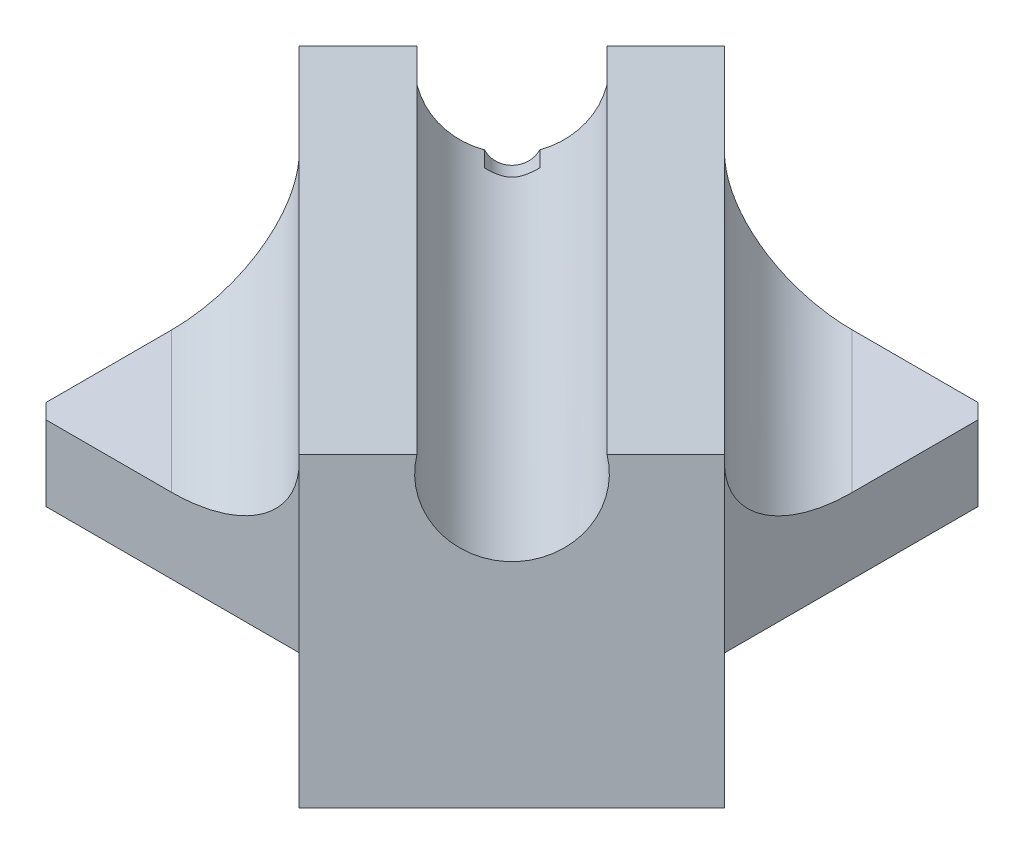
from build123d import *

# Parameters (mm, degrees)
SKETCH1_W                = 32
SKETCH1_H                = 32
BOSS_EXTRUDE1_DEPTH      = 5
BOSS_EXTRUDE2_DEPTH      = 24
BOSS_EXTRUDE2_DEPTH_BACK = 21
SKETCH3_W                = 21.632810856
SKETCH3_H                = 9.374415515
CUT_EXTRUDE1_DEPTH       = 26
CUT_EXTRUDE3_DEPTH       = 3
BOSS_EXTRUDE3_REACH      = 38.453
BOSS_EXTRUDE4_REACH      = 39.779
CHAMFER2_SIZE            = 1
FILLET3_R                = 6
CHAMFER3_SIZE            = 1


with BuildPart() as part:
    # Sketch1 → Boss-Extrude1 (new body)
    with BuildSketch(Plane(origin=(0, 0, 0), x_dir=(1, 0, 0), z_dir=(0, 1, 0))):
        Rectangle(SKETCH1_W, SKETCH1_H)
    extrude(amount=BOSS_EXTRUDE1_DEPTH)

    # Sketch2 → Boss-Extrude2 (add, two sides: drawn at the far end of the back side and taken through both)
    with BuildSketch(Plane(origin=(0.604611907, 0.150768448, 0.604611907), x_dir=(0.7071067811865476, 0, -0.7071067811865476), z_dir=(0.6963642403200193, 0.17364817766692736, 0.6963642403200193)).offset(-BOSS_EXTRUDE2_DEPTH_BACK)):
        with BuildLine():
            Line((-4.469496616, 14), (-10.008100473, 14))
            Line((-10.008100473, 14), (-10.008100473, 2.732717447))
            Line((-10.008100473, 2.732717447), (9.991899527, 2.729904182))
            Line((9.991899527, 2.729904182), (9.991899527, 14))
            Line((9.991899527, 14), (4.469496616, 14))
            ThreePointArc((4.469496616, 14), (0, 8.42), (-4.469496616, 14))
        make_face()
    extrude(amount=BOSS_EXTRUDE2_DEPTH + BOSS_EXTRUDE2_DEPTH_BACK)

    # Sketch3 → Cut-Extrude1 (cut)
    with BuildSketch(Plane(origin=(-14.01903714, -3.495843283, -14.01903714), x_dir=(-0.6756735354111862, -0.16848866057223583, 0.7176885430348756), z_dir=(-0.6963642403200194, -0.17364817766692736, -0.6963642403200193))):
        with Locations((-1.423401453, 7.396880279)):
            Rectangle(SKETCH3_W, SKETCH3_H)
    extrude(amount=CUT_EXTRUDE1_DEPTH, mode=Mode.SUBTRACT)

    # Sketch4 → Cut-Extrude3 (cut)
    with BuildSketch(Plane(origin=(-14.01903714, -3.495843283, -14.01903714), x_dir=(-0.6756735354111862, -0.16848866057223583, 0.7176885430348756), z_dir=(-0.6963642403200194, -0.17364817766692736, -0.6963642403200193))):
        with BuildLine():
            Line((-2.760198528, 8.259804018), (-2.791216986, 8.402799894))
            Line((-2.791216986, 8.402799894), (-0.222019538, 8.960106488))
            Line((-0.222019538, 8.960106488), (-0.191719193, 8.722714198))
            ThreePointArc((-0.191719193, 8.722714198), (-1.330630481, 7.684897625), (-2.760198528, 8.259804018))
        make_face()
    extrude(amount=-CUT_EXTRUDE3_DEPTH, mode=Mode.SUBTRACT)

    # Boss-Extrude3: up to this face of the body (flat: up to its plane)
    boss_extrude3_end = Plane(part.part.faces().sort_by_distance((12.948102595, 6.004070548, 12.962810253))[0])
    # Sketch5 → Boss-Extrude3 (add, up to the picked face)
    with BuildSketch(Plane(origin=(0, 5, 0), x_dir=(1, 0, 0), z_dir=(0, 1, 0)), mode=Mode.PRIVATE) as boss_extrude3_sk1:
        Polygon((16, -1.869320176), (1.846408577, -16), (16, -16), align=None)
    boss_extrude3_tool1 = split(extrude(boss_extrude3_sk1.sketch, amount=BOSS_EXTRUDE3_REACH, mode=Mode.PRIVATE), bisect_by=boss_extrude3_end, keep=Keep.BOTH, mode=Mode.PRIVATE)
    add(boss_extrude3_tool1.solids().sort_by(Axis((11.282136, 5, 11.289773), (0, 1, 0)))[0])

    # Boss-Extrude4: up to this plane
    boss_extrude4_end = Plane(origin=(0, 0, 0), z_dir=(0, 1, 0))
    # Sketch6 → Boss-Extrude4 (add, up to the surface)
    with BuildSketch(Plane(origin=(-0.335099844, 2.689814891, -0.335643177), x_dir=(0.992445248624536, 0.12174417303820455, -0.015191603398808283), z_dir=(0.12268833882070036, -0.9848077432694324, 0.12288726668774345)), mode=Mode.PRIVATE) as boss_extrude4_sk1:
        Polygon((2.19811463, 16.495983278), (10.318063839, 24.741397108), (24.568201142, 10.708094048), (16.459446872, 2.474048136), (16.459446872, 16.714315992), align=None)
    boss_extrude4_tool1 = split(extrude(boss_extrude4_sk1.sketch, amount=BOSS_EXTRUDE4_REACH, mode=Mode.PRIVATE), bisect_by=boss_extrude4_end, keep=Keep.BOTH, mode=Mode.PRIVATE)
    add(boss_extrude4_tool1.solids().sort_by_distance((6.098904, 6.004719, 19.80612))[0])

    # Chamfer2
    # the kernel refuses this chamfer: 1 mm, written as the material it adds along each edge
    with BuildSketch(Plane(origin=(-13.061628157, 6.132633274, -13.069351365), x_dir=(-0.29592354594657705, 0.9534387650849755, 0.05817023455033625), z_dir=(0.6538395061159328, 0.2465782464577767, -0.7153272458224147))) as chamfer2_piece_1_section:
        Polygon((1.448815372, -CHAMFER2_SIZE), (1.448815372 - CHAMFER2_SIZE, 0), (1.448815372, 0), align=None)
    chamfer2_piece_1 = revolve(axis=Axis((-13.061628157, 6.132633274, -13.069351365), (0.6963642403200193, 0.17364817766692733, 0.6963642403200193)), revolution_arc=331.166542544, mode=Mode.PRIVATE)
    chamfer2_piece_1 = chamfer2_piece_1 - Plane(origin=(-13.810185227, 9.756782822, -13.810185227), x_dir=(0.6632365855153953, 0.21502352685856047, -0.7168557138861248), z_dir=(-0.6963642403200193, -0.1736481776669273, -0.6963642403200193)) * Cylinder(4.58, 6, mode=Mode.PRIVATE)
    add(chamfer2_piece_1)

    # Fillet3
    # the kernel refuses this fillet: 6 mm, written as the material it adds along each edge
    with BuildSketch(Plane(origin=(26.606601718, 5, 12.475921893), x_dir=(0, 1, 0), z_dir=(-0.7071067811865475, 0, -0.7071067811865476))) as fillet3_piece_1_section:
        with BuildLine():
            CenterArc((FILLET3_R, FILLET3_R), FILLET3_R, 180, 90)
            Line((0, FILLET3_R), (0, 0))
            Line((0, 0), (FILLET3_R, 0))
        make_face()
    fillet3_piece_1 = extrude(amount=55.271034943, mode=Mode.PRIVATE)
    fillet3_piece_1 = split(fillet3_piece_1, bisect_by=Plane(origin=(7.920941569, 6.446020655, -16), z_dir=(0, 0, 1)), keep=Keep.TOP, mode=Mode.PRIVATE)
    fillet3_piece_1 = split(fillet3_piece_1, bisect_by=Plane(origin=(16, 6.446020655, -7.920941569), z_dir=(-1, 0, 0)), keep=Keep.TOP, mode=Mode.PRIVATE)
    add(fillet3_piece_1)
    with BuildSketch(Plane(origin=(-26.606601718, 5, -12.453010295), x_dir=(0, 1, 0), z_dir=(0.7071067811865475, 0, 0.7071067811865476))) as fillet3_piece_2_section:
        with BuildLine():
            CenterArc((FILLET3_R, FILLET3_R), FILLET3_R, 180, 90)
            Line((0, FILLET3_R), (0, 0))
            Line((0, 0), (FILLET3_R, 0))
        make_face()
    fillet3_piece_2 = extrude(amount=55.238633049, mode=Mode.PRIVATE)
    fillet3_piece_2 = split(fillet3_piece_2, bisect_by=Plane(origin=(-16, 6.446146756, 7.932246434), z_dir=(1, 0, 0)), keep=Keep.TOP, mode=Mode.PRIVATE)
    fillet3_piece_2 = split(fillet3_piece_2, bisect_by=Plane(origin=(-7.932246434, 6.446146756, 16), z_dir=(0, 0, -1)), keep=Keep.TOP, mode=Mode.PRIVATE)
    add(fillet3_piece_2)

    # Chamfer3
    chamfer3_edges = [part.edges().sort_by_distance(p)[0] for p in [
        (16, 2.5, -16),
        (-16, 2.5, 16),
    ]]
    chamfer(chamfer3_edges, length=CHAMFER3_SIZE)


solid = part.part
